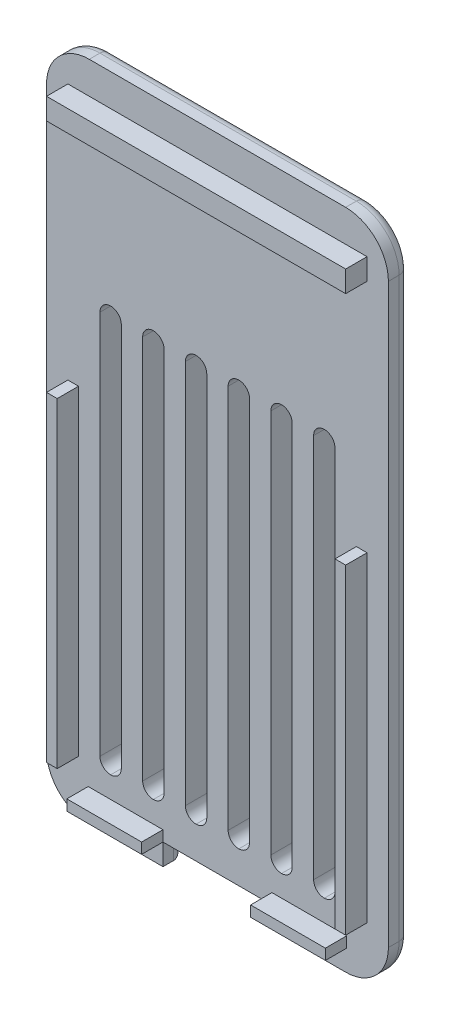
from build123d import *

# Parameters (mm, degrees)
SKETCH1_W           = 32
SKETCH1_H           = 62
BOSS_EXTRUDE4_DEPTH = 2
SKETCH6_W           = 28
SKETCH6_H           = 2
SKETCH6_W_2         = 7
SKETCH6_H_2         = 1
SKETCH6_W_3         = 1
SKETCH6_H_3         = 30
BOSS_EXTRUDE6_DEPTH = 2
SKETCH7_R           = 6
SKETCH7_R_2         = 5.000319164
CUT_EXTRUDE3_DEPTH  = 1.5
SKETCH8_W           = 2
SKETCH8_H           = 38
CUT_EXTRUDE5_DEPTH  = 2
SKETCH26_W          = 10.2
SKETCH26_H          = 2
CUT_EXTRUDE11_DEPTH = 2
FILLET3_R           = 1
FILLET5_R           = 4
FILLET6_R           = 1


with BuildPart() as part:
    # Sketch1 → Boss-Extrude4 (new body)
    with BuildSketch(Plane.XY):
        Rectangle(SKETCH1_W, SKETCH1_H)
    extrude(amount=BOSS_EXTRUDE4_DEPTH)

    # Sketch6 → Boss-Extrude6 (add)
    with BuildSketch(Plane.XY.offset(2)):
        with Locations((0, 27)):
            Rectangle(SKETCH6_W, SKETCH6_H)
        with Locations((-8.6, -28.5)):
            Rectangle(SKETCH6_W_2, SKETCH6_H_2)
        with Locations((-13.5, -11)):
            Rectangle(SKETCH6_W_3, SKETCH6_H_3)
        with Locations((13.5, -11)):
            Rectangle(SKETCH6_W_3, SKETCH6_H_3)
        with Locations((8.6, -28.5)):
            Rectangle(SKETCH6_W_2, SKETCH6_H_2)
    extrude(amount=BOSS_EXTRUDE6_DEPTH)

    # Sketch7 → Cut-Extrude3 (cut)
    # profile 1 of 4: a face of its own
    with BuildSketch(Plane(origin=(0, 0, 0), x_dir=(-1, 0, 0), z_dir=(0, 0, -1))):
        with Locations((8, 23)):
            Circle(SKETCH7_R)
        with Locations((8, 23)):
            Circle(SKETCH7_R_2, mode=Mode.SUBTRACT)
    # profile 2 of 4: a face of its own
    with BuildSketch(Plane(origin=(0, 0, 0), x_dir=(-1, 0, 0), z_dir=(0, 0, -1))):
        with Locations(Location((-8, 23, 0), (0, 0, 180))):
            Circle(SKETCH7_R)
        with Locations(Location((-8, 23, 0), (0, 0, 180))):
            Circle(SKETCH7_R_2, mode=Mode.SUBTRACT)
    # profile 3 of 4: a face of its own
    with BuildSketch(Plane(origin=(0, 0, 0), x_dir=(-1, 0, 0), z_dir=(0, 0, -1))):
        Polygon((7.449564134, 19.902085928), (7.449564134, 26.125), (8.241594022, 26.125), (8.241594022, 20.615660025), (9.067247821, 20.615660025), (9.067247821, 19.902085928), align=None)
    # profile 4 of 4: a face of its own
    with BuildSketch(Plane(origin=(0, 0, 0), x_dir=(-1, 0, 0), z_dir=(0, 0, -1))):
        with BuildLine():
            Line((-7.146948941, 25.376463263), (-10.108343711, 25.376463263))
            Line((-10.108343711, 25.376463263), (-10.108343711, 26.031506849))
            Line((-10.108343711, 26.031506849), (-5.96886675, 26.031506849))
            Line((-5.96886675, 26.031506849), (-5.96886675, 25.471108344))
            add(Edge.make_bspline(
                [(-5.96886675, 25.471108344), (-6.141971745, 25.332246025), (-6.393074253, 25.128048459), (-6.717159934, 24.860884743), (-6.938355226, 24.675665503), (-7.14521645, 24.500220273), (-7.337036334, 24.334147369), (-7.515021507, 24.179302523), (-7.729935684, 23.986290529), (-7.97797696, 23.749213926), (-8.254030773, 23.459208844), (-8.501907476, 23.159401339), (-8.692650042, 22.906276826), (-8.827236908, 22.7005165), (-8.914850872, 22.548009682), (-8.987343685, 22.394896597), (-9.047188475, 22.243011314), (-9.09511833, 22.092158743), (-9.14011918, 21.893098726), (-9.153639256, 21.741878323), (-9.153175592, 21.641718555)],
                knots=[0, 0, 0, 0, 0.130040941, 0.189652936, 0.246118775, 0.299098592, 0.348595518, 0.394796265, 0.437339888, 0.517855819, 0.595805403, 0.671798956, 0.745699159, 0.781390574, 0.815816171, 0.848675559, 0.880566293, 0.911416805, 0.941336485, 1, 1, 1, 1], degree=3))
            add(Edge.make_bspline(
                [(-9.153175592, 21.641718555), (-9.155082227, 21.552888892), (-9.144519697, 21.423140421), (-9.117017207, 21.256160493), (-9.086176124, 21.141966589), (-9.049844313, 21.034116343), (-9.002140941, 20.934767093), (-8.946696453, 20.842593454), (-8.883433554, 20.757430331), (-8.810058845, 20.68075797), (-8.724921804, 20.615898841), (-8.631522153, 20.558997899), (-8.52626692, 20.514689776), (-8.41184588, 20.478122069), (-8.238594227, 20.444792793), (-8.102433508, 20.436059356), (-8.00871731, 20.436239103)],
                knots=[0, 0, 0, 0, 0.139728186, 0.204784982, 0.266341208, 0.325916068, 0.383845258, 0.439595464, 0.495191981, 0.550699936, 0.606173196, 0.663381541, 0.722556505, 0.785650329, 0.852353324, 1, 1, 1, 1], degree=3))
            add(Edge.make_bspline(
                [(-8.00871731, 20.436239103), (-7.916381499, 20.437963905), (-7.780275222, 20.44531508), (-7.607573636, 20.484711085), (-7.489539865, 20.524886263), (-7.37894443, 20.575440972), (-7.278056027, 20.640240509), (-7.183251352, 20.713479274), (-7.098817495, 20.800136263), (-7.023700984, 20.896089204), (-6.955094248, 20.998590264), (-6.898475794, 21.110250127), (-6.849345945, 21.228689465), (-6.811085908, 21.35564304), (-6.77026818, 21.538429964), (-6.756832641, 21.68156666), (-6.752179328, 21.778704857)],
                knots=[0, 0, 0, 0, 0.134196199, 0.196562655, 0.256347301, 0.314798293, 0.372427992, 0.429881299, 0.488208125, 0.547352693, 0.606466609, 0.666785475, 0.728614883, 0.792224418, 0.858834798, 1, 1, 1, 1], degree=3))
            Line((-6.752179328, 21.778704857), (-5.99377335, 21.778704857))
            add(Edge.make_bspline(
                [(-5.99377335, 21.778704857), (-5.997486049, 21.626043992), (-6.022968038, 21.403553268), (-6.087771701, 21.119090113), (-6.154533355, 20.925565149), (-6.235258471, 20.744918428), (-6.332722054, 20.577794308), (-6.448082734, 20.425562017), (-6.577838607, 20.287424291), (-6.719500697, 20.163361209), (-6.874023412, 20.058172324), (-7.036357792, 19.965442189), (-7.21032699, 19.892804952), (-7.393628445, 19.834880004), (-7.656331886, 19.77911898), (-7.861386403, 19.766430592), (-8, 19.765006227)],
                knots=[0, 0, 0, 0, 0.143256095, 0.209727491, 0.273583639, 0.335170915, 0.395274724, 0.454838861, 0.51413324, 0.572990339, 0.631272766, 0.689392012, 0.748255565, 0.807926753, 0.869702493, 1, 1, 1, 1], degree=3))
            add(Edge.make_bspline(
                [(-8, 19.765006227), (-8.141000178, 19.763539171), (-8.347034063, 19.780521722), (-8.612322806, 19.829086312), (-8.79374631, 19.885647608), (-8.96555498, 19.953126433), (-9.125345548, 20.038241229), (-9.273376818, 20.138643722), (-9.409243356, 20.253208897), (-9.531806427, 20.381382972), (-9.637390513, 20.522817866), (-9.728706814, 20.67446601), (-9.80046805, 20.839449985), (-9.857663027, 21.014979064), (-9.914464012, 21.270428027), (-9.92596825, 21.470796687), (-9.927770859, 21.606849315)],
                knots=[0, 0, 0, 0, 0.139977399, 0.205129271, 0.267661615, 0.328584124, 0.388397961, 0.44723, 0.506092426, 0.564763589, 0.623116047, 0.681221368, 0.740343609, 0.801549192, 0.864527945, 1, 1, 1, 1], degree=3))
            add(Edge.make_bspline(
                [(-9.927770859, 21.606849315), (-9.928242812, 21.72559986), (-9.915013433, 21.903984583), (-9.870131257, 22.138500082), (-9.822350184, 22.313101458), (-9.762269632, 22.486490626), (-9.690286657, 22.659318649), (-9.602323879, 22.829621189), (-9.469377828, 23.054284468), (-9.285596836, 23.323787524), (-9.052240665, 23.632715958), (-8.802279105, 23.919912782), (-8.579780596, 24.144048337), (-8.391224564, 24.317762692), (-8.241857572, 24.454065056), (-8.081858709, 24.594549679), (-7.913468988, 24.741333436), (-7.734490681, 24.891808295), (-7.479898932, 25.106191886), (-7.283114849, 25.268511143), (-7.146948941, 25.376463263)],
                knots=[0, 0, 0, 0, 0.073605163, 0.110554154, 0.147890148, 0.185738035, 0.22426503, 0.263861232, 0.3044708, 0.386061806, 0.465952502, 0.544398616, 0.621927399, 0.661628021, 0.703351885, 0.747296454, 0.793637954, 0.841849967, 0.892268874, 1, 1, 1, 1], degree=3))
        make_face()
    extrude(amount=-CUT_EXTRUDE3_DEPTH, mode=Mode.SUBTRACT)

    # Sketch8 → Cut-Extrude5 (cut)
    with BuildSketch(Plane(origin=(0, 0, 0), x_dir=(-1, 0, 0), z_dir=(0, 0, -1))):
        with Locations((6, -7)):
            Rectangle(SKETCH8_W, SKETCH8_H)
        with Locations((2, -7)):
            Rectangle(SKETCH8_W, SKETCH8_H)
        with Locations((-2, -7)):
            Rectangle(SKETCH8_W, SKETCH8_H)
        with Locations((-6, -7)):
            Rectangle(SKETCH8_W, SKETCH8_H)
        with Locations((-10, -7)):
            Rectangle(SKETCH8_W, SKETCH8_H)
        with Locations((10, -7)):
            Rectangle(SKETCH8_W, SKETCH8_H)
    extrude(amount=-CUT_EXTRUDE5_DEPTH, mode=Mode.SUBTRACT)

    # Sketch26 → Cut-Extrude11 (cut)
    with BuildSketch(Plane.XZ.offset(31)):
        with Locations((0, 1)):
            Rectangle(SKETCH26_W, SKETCH26_H)
    extrude(amount=-CUT_EXTRUDE11_DEPTH, mode=Mode.SUBTRACT)

    # Fillet3
    fillet3_edges = [part.edges().sort_by_distance(p)[0] for p in [
        (-9, 12, 1),
        (-5, 12, 1),
        (-1, 12, 1),
        (3, 12, 1),
        (7, 12, 1),
        (11, 12, 1),
        (9, 12, 1),
        (5, 12, 1),
        (1, 12, 1),
        (-3, 12, 1),
        (-7, 12, 1),
        (-11, 12, 1),
        (-5, -26, 1),
        (-1, -26, 1),
        (3, -26, 1),
        (7, -26, 1),
        (11, -26, 1),
        (9, -26, 1),
        (5, -26, 1),
        (1, -26, 1),
        (-3, -26, 1),
        (-7, -26, 1),
        (-9, -26, 1),
        (-11, -26, 1),
    ]]
    fillet(fillet3_edges, radius=FILLET3_R - 0.0001)  # a hair under: the kernel refuses the full size

    # Fillet5
    fillet5_edges = [part.edges().sort_by_distance(p)[0] for p in [
        (16, -31, 1),
        (-16, -31, 1),
        (-16, 31, 1),
        (16, 31, 1),
    ]]
    fillet(fillet5_edges, radius=FILLET5_R)

    # Fillet6
    fillet6_edges = [part.edges().sort_by_distance(p)[0] for p in [
        (8.55, -31, 0),
        (-5.1, -30, 0),
        (0, -29, 0),
        (5.1, -30, 0),
        (-16, 0, 0),
        (-8.55, -31, 0),
        (0, 31, 0),
        (16, 0, 0),
        (14.828427125, 29.828427125, 0),
        (14.828427125, -29.828427125, 0),
        (-14.828427125, -29.828427125, 0),
        (-14.828427125, 29.828427125, 0),
    ]]
    fillet(fillet6_edges, radius=FILLET6_R)


solid = part.part
